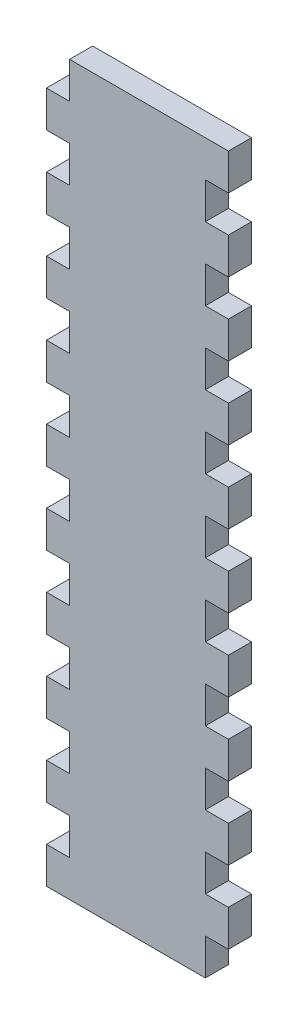
from build123d import *

# Parameters (mm, degrees)
SKETCH1_W           = 37.3
SKETCH1_H           = 200
BOSS_EXTRUDE1_DEPTH = 6.35
SKETCH10_W          = 6.35
SKETCH10_H          = 10
BOSS_EXTRUDE3_DEPTH = 6.35
SKETCH11_W          = 6.35
SKETCH11_H          = 10
BOSS_EXTRUDE4_DEPTH = 6.35
LPATTERN5_COUNT     = 10
LPATTERN5_PITCH     = 20


with BuildPart() as part:
    # Sketch1 → Boss-Extrude1 (new body)
    with BuildSketch(Plane.XY):
        Rectangle(SKETCH1_W, SKETCH1_H)
    extrude(amount=BOSS_EXTRUDE1_DEPTH)

    # Sketch10 → Boss-Extrude3 (add)
    with BuildSketch(Plane.XY):
        with Locations((-21.825, -95)):
            Rectangle(SKETCH10_W, SKETCH10_H)
    boss_extrude3 = extrude(amount=BOSS_EXTRUDE3_DEPTH)

    # Sketch11 → Boss-Extrude4 (add)
    with BuildSketch(Plane.XY):
        with Locations((21.825, -85)):
            Rectangle(SKETCH11_W, SKETCH11_H)
    boss_extrude4 = extrude(amount=BOSS_EXTRUDE4_DEPTH)

    # LPattern5: Boss-Extrude3, Boss-Extrude4 ×10
    with Locations(*[(0, i * LPATTERN5_PITCH, 0) for i in range(1, LPATTERN5_COUNT)]):
        add(boss_extrude3)
        add(boss_extrude4)


solid = part.part
